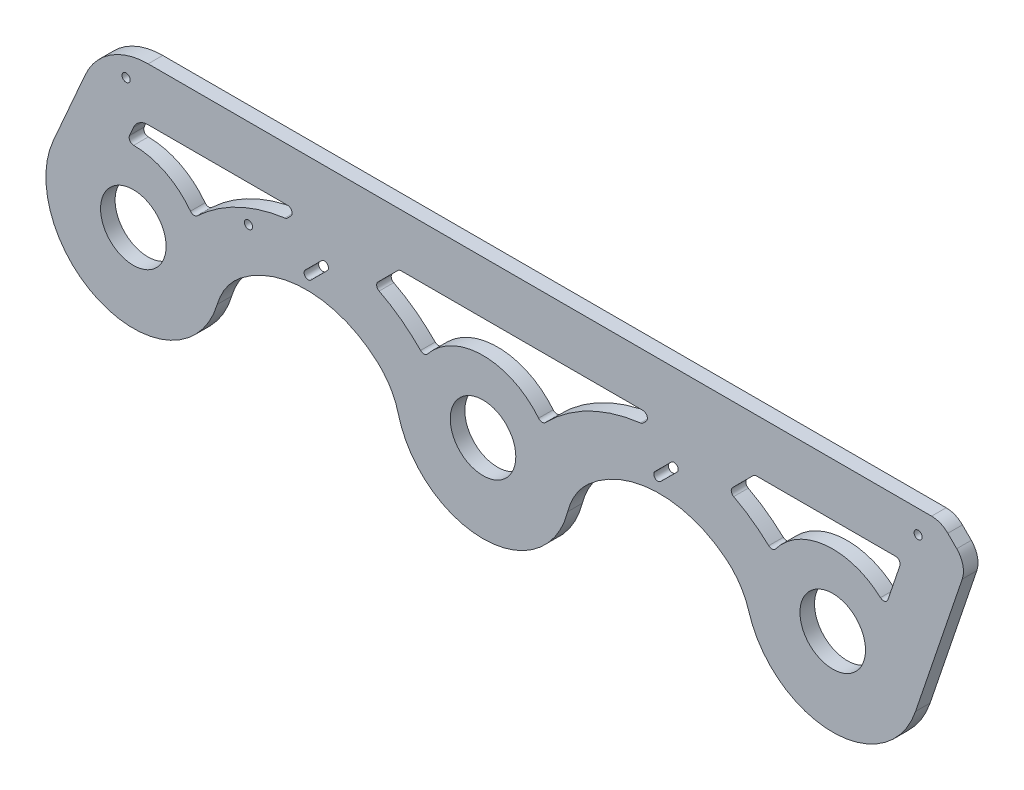
from build123d import *
from build123d.topology import SkipClean

# Parameters (mm, degrees)
SKETCH1_R           = 14.2875
BOSS_EXTRUDE1_DEPTH = 6.35
FILLET1_R           = 10
FILLET2_R           = 20
SKETCH2_R           = 1.778
CUT_EXTRUDE1_DEPTH  = 6.35
FILLET4_R           = 28.4734
BOSS_EXTRUDE2_DEPTH = 6.35
FILLET7_R           = 30
CUT_EXTRUDE4_DEPTH  = 6.35
FILLET9_DEPTH       = 6.35
SKETCH6_R           = 1.778
CUT_EXTRUDE5_DEPTH  = 10
CHAMFER1_SIZE       = 15
CHAMFER1_SIZE2      = 11.830755168
FILLET11_R          = 10
BOSS_EXTRUDE3_DEPTH = 6.35
SKETCH8_R           = 1.778
BOSS_EXTRUDE4_DEPTH = 6.35
CUT_EXTRUDE6_DEPTH  = 10
FILLET12_R          = 10
FILLET13_R          = 10
FILLET14_R          = 10
FILLET15_R          = 10
FILLET16_R          = 10
CUT_EXTRUDE7_DEPTH  = 10
BOSS_EXTRUDE5_START = -6.35
SKETCH10_R          = 1.778
BOSS_EXTRUDE5_DEPTH = 6.35
FILLET17_R          = 30
BOSS_EXTRUDE6_START = -6.35
BOSS_EXTRUDE6_DEPTH = 6.35
SCALE1_SCALE        = 0.333333333


with BuildPart() as part:
    # Sketch1 → Boss-Extrude1 (new body)
    with BuildSketch(Plane.XY):
        with BuildLine():
            Line((76.2, 30), (19.765397885, -21.612188753))
            ThreePointArc((19.765397885, -21.612188753), (-7.664310495, -28.266871084), (-27.975511048, -8.66766623))
            Line((-27.975511048, -8.66766623), (-30.661018302, 0))
            Line((-30.661018302, 0), (-10.522036605, 65))
            Line((-10.522036605, 65), (355.6, 65))
            Line((355.6, 65), (332.775511048, -8.66766623))
            ThreePointArc((332.775511048, -8.66766623), (312.464310495, -28.266871084), (285.034602115, -21.612188753))
            Line((285.034602115, -21.612188753), (228.6, 30))
            Line((228.6, 30), (172.803916322, -24.185422532))
            ThreePointArc((172.803916322, -24.185422532), (152.4, -32.637001398), (131.996083678, -24.185422532))
            Line((131.996083678, -24.185422532), (76.2, 30))
        make_face()
        Circle(SKETCH1_R, mode=Mode.SUBTRACT)
        with Locations((152.4, -3.175)):
            Circle(SKETCH1_R, mode=Mode.SUBTRACT)
        with Locations((304.8, 0)):
            Circle(SKETCH1_R, mode=Mode.SUBTRACT)
    extrude(amount=BOSS_EXTRUDE1_DEPTH)

    # Fillet1
    fillet1_edges = [part.edges().sort_by_distance(p)[0] for p in [
        (-10.522036605, 65, 3.175),
        (355.6, 65, 3.175),
    ]]
    fillet(fillet1_edges, radius=FILLET1_R)

    # Fillet2
    fillet2_edges = [part.edges().sort_by_distance(p)[0] for p in [
        (228.6, 30, 3.175),
        (76.2, 30, 3.175),
    ]]
    fillet(fillet2_edges, radius=FILLET2_R)

    # Sketch2 → Cut-Extrude1 (cut)
    with BuildSketch(Plane(origin=(0, 0, 0), x_dir=(-1, 0, 0), z_dir=(0, 0, -1))):
        with Locations((-229.01165953, 23.51851186)):
            Circle(SKETCH2_R)
        with Locations((-342.03271747, 55)):
            Circle(SKETCH2_R)
        with Locations((-76.34605429, 23.51851186)):
            Circle(SKETCH2_R)
        with Locations(Location((3.151363828, 55, 0), (0, 0, 180))):
            Circle(SKETCH2_R)
    extrude(amount=-CUT_EXTRUDE1_DEPTH, mode=Mode.SUBTRACT)

    # Fillet4
    fillet4_edges = [part.edges().sort_by_distance(p)[0] for p in [
        (-30.661018302, 0, 3.175),
    ]]
    fillet(fillet4_edges, radius=FILLET4_R)

    # Sketch4 → Boss-Extrude2 (add)
    with BuildSketch(Plane.XY.offset(6.35)):
        with BuildLine():
            ThreePointArc((-12.703394916, 57.95951045), (-9.084528898, 63.04969268), (-3.151363828, 65))
            Line((-3.151363828, 65), (-13.151363828, 65))
            Line((-13.151363828, 65), (-34.906140988, 15.269948308))
            ThreePointArc((-34.906140988, 15.269948308), (-10.316360553, -36.676732474), (37.748130536, -5.166105019))
            Line((37.748130536, -5.166105019), (19.765397885, -21.612188753))
            ThreePointArc((19.765397885, -21.612188753), (-7.664310495, -28.266871084), (-27.975511048, -8.66766623))
            Line((-27.975511048, -8.66766623), (-28.050159667, -8.426732485))
            ThreePointArc((-28.050159667, -8.426732485), (-29.325679471, 0), (-28.050159667, 8.426732485))
            Line((-28.050159667, 8.426732485), (-12.703394916, 57.95951045))
        make_face()
        with BuildLine():
            Line((367.03271747, 65), (342.03271747, 65))
            ThreePointArc((342.03271747, 65), (350.08241015, 60.93316507), (351.584748558, 52.04048955))
            Line((351.584748558, 52.04048955), (332.775511048, -8.66766623))
            ThreePointArc((332.775511048, -8.66766623), (312.464310495, -28.266871084), (285.034602115, -21.612188753))
            Line((285.034602115, -21.612188753), (267.051869464, -5.166105019))
            ThreePointArc((267.051869464, -5.166105019), (301.177259665, -37.927374711), (340.887568868, -12.218730424))
            Line((340.887568868, -12.218730424), (367.03271747, 65))
        make_face()
        with BuildLine():
            Line((62.290842982, 17.279399331), (60.592342389, 15.72603792))
            Line((60.592342389, 15.72603792), (68.130864542, 20.996768873))
            ThreePointArc((68.130864542, 20.996768873), (65.048790473, 19.392687011), (62.290842982, 17.279399331))
        make_face()
        with BuildLine():
            ThreePointArc((74.888341467, 22.500495492), (71.444046197, 22.043232685), (68.130864542, 20.996768873))
            Line((68.130864542, 20.996768873), (105.753753933, 1.29937195))
            Line((105.753753933, 1.29937195), (89.721872743, 16.868462091))
            ThreePointArc((89.721872743, 16.868462091), (84.206374965, 20.662880592), (77.747671619, 22.424549857))
            ThreePointArc((77.747671619, 22.424549857), (76.393262458, 25.295885031), (74.888341467, 22.500495492))
        make_face()
        with BuildLine():
            Line((220.832871891, 20.771986703), (256.207126926, 4.751939547))
            Line((256.207126926, 4.751939547), (242.509157018, 17.279399331))
            ThreePointArc((242.509157018, 17.279399331), (236.916143222, 20.892449631), (230.446997722, 22.469184326))
            ThreePointArc((230.446997722, 22.469184326), (229.01165953, 25.29651186), (227.576321337, 22.469184326))
            ThreePointArc((227.576321337, 22.469184326), (224.130268968, 21.915910418), (220.832871891, 20.771986703))
        make_face()
        with BuildLine():
            Line((211.556759647, 13.448745522), (220.832871891, 20.771986703))
            ThreePointArc((220.832871891, 20.771986703), (217.784547298, 19.072249628), (215.078127257, 16.868462091))
            Line((215.078127257, 16.868462091), (211.556759647, 13.448745522))
        make_face()
        with BuildLine():
            Line((131.996083678, -24.185422532), (114.514059271, -7.208050345))
            ThreePointArc((114.514059271, -7.208050345), (152.4, -41.275), (190.285940729, -7.208050345))
            Line((190.285940729, -7.208050345), (172.803916322, -24.185422532))
            ThreePointArc((172.803916322, -24.185422532), (152.4, -32.637001398), (131.996083678, -24.185422532))
        make_face()
    extrude(amount=-BOSS_EXTRUDE2_DEPTH)

    # Fillet7
    # the kernel refuses this fillet: 30 mm, written as the material it adds along each edge
    with BuildSketch(Plane(origin=(220.832871891, 20.771986703, 6.35), x_dir=(-0.7848829847834699, -0.6196440108621978, 0), z_dir=(0, 0, -1))) as fillet7_piece_1:
        with BuildLine():
            CenterArc((18.669895515, -29.207154991), FILLET7_R, 103.201773783, 49.45286053)
            Line((-7.977718615, -15.426564975), (0, 0))
            Line((0, 0), (11.818465203, 0))
        make_face()
    extrude(amount=6.35)
    with BuildSketch(Plane(origin=(68.130864542, 20.996768873, 6.35), x_dir=(-0.819550218760279, -0.5730073637659283, 0), z_dir=(0, 0, -1))) as fillet7_piece_2:
        with BuildLine():
            CenterArc((19.112116789, -28.314616862), FILLET7_R, 109.296600171, 43.297831689)
            Line((-7.521002941, -14.506034983), (0, 0))
            Line((0, 0), (9.198365128, 0))
        make_face()
    extrude(amount=6.35)
    # the kernel refuses this fillet: 30 mm, written as the material it takes off along each edge
    with BuildSketch(Plane(origin=(-13.151363828, 65, 55.403084312), x_dir=(-0.4007860448353176, -0.9161716794713002, 0), z_dir=(0, 0, -1))) as fillet7_2_piece_1:
        with BuildLine():
            CenterArc((FILLET7_R * 0.65404112416, -FILLET7_R), FILLET7_R, 90, 66.372672864)
            Line((-FILLET7_R * 0.262130555312, -FILLET7_R * 0.599213955165), (0, 0))
            Line((0, 0), (FILLET7_R * 0.65404112416, 0))
        make_face()
    extrude(amount=104.456168624, mode=Mode.SUBTRACT)

    # Sketch5 → Cut-Extrude4 (cut)
    with BuildSketch(Plane.XY.offset(6.35)):
        with BuildLine():
            ThreePointArc((202.727550006, 25.783673337), (222.609463156, 31.248183301), (242.841525508, 27.271376461))
            Line((242.841525508, 27.271376461), (264.569178734, 17.431507638))
            Line((264.569178734, 17.431507638), (281.763141289, 1.706792524))
            ThreePointArc((281.763141289, 1.706792524), (305.653980027, 23.084209281), (327.9, 0))
            ThreePointArc((327.9, 0), (327.592925131, -3.754006392), (326.679864589, -7.408206635))
            Line((326.679864589, -7.408206635), (346.117455511, 50))
            Line((346.117455511, 50), (6.469869897, 50))
            ThreePointArc((6.469869897, 50), (-1.740585021, 47.553423041), (-7.272705295, 41.011790673))
            Line((-7.272705295, 41.011790673), (-21.163565796, 9.258157636))
            ThreePointArc((-21.163565796, 9.258157636), (3.890126649, 22.770088156), (23.036858711, 1.706792524))
            Line((23.036858711, 1.706792524), (52.825875761, 28.950297628))
            ThreePointArc((52.825875761, 28.950297628), (71.4348738, 31.756464685), (89.564149012, 26.706834809))
            Line((89.564149012, 26.706834809), (114.641099784, 13.577841769))
            Line((114.641099784, 13.577841769), (129.424605527, -0.77890968))
            ThreePointArc((129.424605527, -0.77890968), (152.4, 19.925), (175.375394473, -0.77890968))
            Line((175.375394473, -0.77890968), (202.727550006, 25.783673337))
        make_face()
    extrude(amount=-CUT_EXTRUDE4_DEPTH, mode=Mode.SUBTRACT)

    # Fillet9: read off the stored shape, not the designer's step
    # Fillet9 outline → Fillet9 (add)
    with BuildSketch(Plane.XY):
        with BuildLine():
            Line((346.117455511, 50), (332.173947538, 50))
            ThreePointArc((332.173947538, 50), (340.300144637, 45.827943094), (341.64575039, 36.792984141))
            Line((341.64575039, 36.792984141), (346.117455511, 50))
        make_face()
        with BuildLine():
            Line((326.679864589, -7.408206635), (336.428348814, 21.383581349))
            ThreePointArc((336.428348814, 21.383581349), (329.483593888, 14.915162915), (320.262725429, 17.161413762))
            ThreePointArc((320.262725429, 17.161413762), (327.150253218, 5.837480712), (326.679864589, -7.408206635))
        make_face()
        with BuildLine():
            ThreePointArc((0.126311649, 23.099654659), (-8.202890478, 27.648769951), (-8.980724779, 37.107365609))
            Line((-8.980724779, 37.107365609), (-21.163565796, 9.258157636))
            ThreePointArc((-21.163565796, 9.258157636), (-12.591198333, 19.366768562), (0.126311649, 23.099654659))
        make_face()
    extrude(amount=FILLET9_DEPTH)

    # Sketch6 → Cut-Extrude5 (cut)
    with BuildSketch(Plane.XY.offset(6.35)):
        with Locations((76.2, 20.164023691)):
            Circle(SKETCH6_R)
        with Locations((228.6, 20.32759964)):
            Circle(SKETCH6_R)
    extrude(amount=-CUT_EXTRUDE5_DEPTH, mode=Mode.SUBTRACT)

    # Chamfer1
    chamfer1_edges = [part.edges().sort_by_distance(p)[0] for p in [
        (367.03271747, 65, 3.175),
    ]]
    chamfer1_side = [part.faces().sort_by_distance(p)[0] for p in [
        (186.751293683, 65, 3.175),
    ]]
    chamfer(chamfer1_edges, length=CHAMFER1_SIZE, length2=CHAMFER1_SIZE2, reference=chamfer1_side[0])

    # Fillet11
    fillet11_edges = [part.edges().sort_by_distance(p)[0] for p in [
        (363.238575525, 53.794141945, 3.175),
        (352.03271747, 65, 3.175),
    ]]
    fillet(fillet11_edges, radius=FILLET11_R)

    # Sketch7 → Boss-Extrude3 (add)
    with BuildSketch(Plane.XY.offset(6.35)):
        Polygon((100.225182041, 58.888519513), (69.228437645, 27.891775117), (86.023226415, 23.473360451), (115.72256861, 53.172702646), align=None)
        Polygon((224.083172996, 27.891775117), (239.038298252, 21.633696938), (270.57730396, 53.172702646), (247.971808558, 51.78041068), align=None)
    extrude(amount=-BOSS_EXTRUDE3_DEPTH)

    # Sketch8 → Boss-Extrude4 (add)
    # profile 1 of 8: a face of its own
    with BuildSketch(Plane.XY.offset(6.35)):
        with BuildLine():
            Line((42.965540082, 19.932541018), (26.540335697, 4.910892646))
            ThreePointArc((26.540335697, 4.910892646), (26.03493106, 4.232890698), (25.538925832, 3.547982455))
            Line((25.538925832, 3.547982455), (37.748130536, -5.166105019))
            ThreePointArc((37.748130536, -5.166105019), (44.188663643, 2.104358832), (52.003991477, 7.871573252))
            Line((52.003991477, 7.871573252), (60.592342389, 15.72603792))
            ThreePointArc((60.592342389, 15.72603792), (71.406290885, 16.717093686), (81.86459706, 13.793481951))
            ThreePointArc((81.86459706, 13.793481951), (100.496139451, 6.878937362), (114.514059271, -7.208050345))
            Line((114.514059271, -7.208050345), (127.169254419, 0.844653286))
            ThreePointArc((127.169254419, 0.844653286), (126.658671717, 1.633641021), (126.136055565, 2.414709969))
            Line((126.136055565, 2.414709969), (114.641099784, 13.577841769))
            Line((114.641099784, 13.577841769), (89.564149012, 26.706834809))
            ThreePointArc((89.564149012, 26.706834809), (89.463102992, 26.759574333), (89.361923711, 26.812057747))
            Line((89.361923711, 26.812057747), (90.030119482, 27.480253519))
            ThreePointArc((90.030119482, 27.480253519), (80.261374749, 29.051255746), (70.367134521, 29.030471993))
            ThreePointArc((70.367134521, 29.030471993), (56.12315118, 26.117501091), (42.965540082, 19.932541018))
        make_face()
        with Locations((76.2, 20.164023691)):
            Circle(SKETCH8_R, mode=Mode.SUBTRACT)
    # profile 2 of 8: a face of its own
    with BuildSketch(Plane.XY.offset(6.35)):
        with BuildLine():
            ThreePointArc((126.136055565, 2.414709969), (110.406465662, 18.294217169), (90.030119482, 27.480253519))
            Line((90.030119482, 27.480253519), (89.361923711, 26.812057747))
            ThreePointArc((89.361923711, 26.812057747), (89.463102992, 26.759574333), (89.564149012, 26.706834809))
            Line((89.564149012, 26.706834809), (114.641099784, 13.577841769))
            Line((114.641099784, 13.577841769), (126.136055565, 2.414709969))
        make_face()
    # profile 3 of 8: a face of its own
    with BuildSketch(Plane.XY.offset(6.35)):
        with BuildLine():
            Line((60.592342389, 15.72603792), (52.003991477, 7.871573252))
            ThreePointArc((52.003991477, 7.871573252), (66.43379909, 13.356222223), (81.86459706, 13.793481951))
            ThreePointArc((81.86459706, 13.793481951), (71.406290885, 16.717093686), (60.592342389, 15.72603792))
        make_face()
    # profile 4 of 8: a face of its own
    with BuildSketch(Plane.XY.offset(6.35)):
        with BuildLine():
            Line((196.372099466, 19.611685086), (178.663944435, 2.414709969))
            ThreePointArc((178.663944435, 2.414709969), (178.141328283, 1.633641021), (177.630745581, 0.844653286))
            Line((177.630745581, 0.844653286), (190.285940729, -7.208050345))
            ThreePointArc((190.285940729, -7.208050345), (197.093762385, 1.152818304), (205.650401581, 7.712885828))
            Line((205.650401581, 7.712885828), (211.556759647, 13.448745522))
            ThreePointArc((211.556759647, 13.448745522), (223.983698914, 16.277662761), (236.463614039, 13.692452762))
            ThreePointArc((236.463614039, 13.692452762), (253.661443339, 7.350945008), (267.051869464, -5.166105019))
            Line((267.051869464, -5.166105019), (279.261074168, 3.547982455))
            ThreePointArc((279.261074168, 3.547982455), (278.76506894, 4.232890698), (278.259664303, 4.910892646))
            Line((278.259664303, 4.910892646), (264.569178734, 17.431507638))
            Line((264.569178734, 17.431507638), (244.104163185, 26.699561871))
            Line((244.104163185, 26.699561871), (244.695857174, 27.29125586))
            ThreePointArc((244.695857174, 27.29125586), (235.069370607, 28.974257477), (225.297764534, 29.106366656))
            ThreePointArc((225.297764534, 29.106366656), (210.236231282, 26.182975027), (196.372099466, 19.611685086))
        make_face()
        with Locations((228.6, 20.32759964)):
            Circle(SKETCH8_R, mode=Mode.SUBTRACT)
    # profile 5 of 8: a face of its own
    with BuildSketch(Plane.XY.offset(6.35)):
        with BuildLine():
            Line((211.556759647, 13.448745522), (205.650401581, 7.712885828))
            ThreePointArc((205.650401581, 7.712885828), (220.5349661, 13.392794234), (236.463614039, 13.692452762))
            ThreePointArc((236.463614039, 13.692452762), (223.983698914, 16.277662761), (211.556759647, 13.448745522))
        make_face()
    # profile 6 of 8: a face of its own
    with BuildSketch(Plane.XY.offset(6.35)):
        with BuildLine():
            ThreePointArc((278.259664303, 4.910892646), (263.371186182, 18.940642396), (244.695857174, 27.29125586))
            Line((244.695857174, 27.29125586), (244.104163185, 26.699561871))
            Line((244.104163185, 26.699561871), (264.569178734, 17.431507638))
            Line((264.569178734, 17.431507638), (278.259664303, 4.910892646))
        make_face()
    # profile 7 of 8: a face of its own
    with BuildSketch(Plane.XY.offset(6.35)):
        with BuildLine():
            ThreePointArc((196.372099466, 19.611685086), (186.64361318, 11.913598089), (178.663944435, 2.414709969))
            Line((178.663944435, 2.414709969), (196.372099466, 19.611685086))
        make_face()
    # profile 8 of 8: a face of its own
    with BuildSketch(Plane.XY.offset(6.35)):
        with BuildLine():
            ThreePointArc((42.965540082, 19.932541018), (34.065540526, 13.173341548), (26.540335697, 4.910892646))
            Line((26.540335697, 4.910892646), (42.965540082, 19.932541018))
        make_face()
    extrude(amount=-BOSS_EXTRUDE4_DEPTH)

    # Sketch8<3> → Cut-Extrude6 (cut)
    with SkipClean():  # the faces are left unmerged after this step: merging them gives an invalid solid
        with BuildSketch(Plane.XY.offset(6.35)):
            with BuildLine():
                Line((26.540335697, 4.910892646), (23.036858711, 1.706792524))
                ThreePointArc((23.036858711, 1.706792524), (23.086771831, 0.781643421), (23.099546395, -0.144763074))
                ThreePointArc((23.099546395, -0.144763074), (24.756867192, 2.425991729), (26.540335697, 4.910892646))
            make_face()
            with BuildLine():
                Line((52.825875761, 28.950297628), (42.965540082, 19.932541018))
                ThreePointArc((42.965540082, 19.932541018), (56.12315118, 26.117501091), (70.367134521, 29.030471993))
                Line((70.367134521, 29.030471993), (72.972728384, 31.636065856))
                ThreePointArc((72.972728384, 31.636065856), (62.745683135, 31.445529161), (52.825875761, 28.950297628))
            make_face()
            with BuildLine():
                ThreePointArc((52.003991477, 7.871573252), (44.188663643, 2.104358832), (37.748130536, -5.166105019))
                Line((37.748130536, -5.166105019), (52.003991477, 7.871573252))
            make_face()
            with BuildLine():
                Line((105.753753933, 1.29937195), (114.514059271, -7.208050345))
                ThreePointArc((114.514059271, -7.208050345), (100.496139451, 6.878937362), (81.86459706, 13.793481951))
                ThreePointArc((81.86459706, 13.793481951), (82.236984648, 13.608280674), (82.606769012, 13.417934797))
                Line((82.606769012, 13.417934797), (105.753753933, 1.29937195))
            make_face()
            with BuildLine():
                ThreePointArc((126.136055565, 2.414709969), (127.78416506, -0.142246527), (129.303415047, -2.777805464))
                ThreePointArc((129.303415047, -2.777805464), (129.342339274, -1.777043687), (129.424605527, -0.77890968))
                Line((129.424605527, -0.77890968), (126.136055565, 2.414709969))
            make_face()
            with BuildLine():
                ThreePointArc((205.650401581, 7.712885828), (197.093762385, 1.152818304), (190.285940729, -7.208050345))
                Line((190.285940729, -7.208050345), (205.650401581, 7.712885828))
            make_face()
            with BuildLine():
                Line((256.207126926, 4.751939547), (267.051869464, -5.166105019))
                ThreePointArc((267.051869464, -5.166105019), (253.661443339, 7.350945008), (236.463614039, 13.692452762))
                ThreePointArc((236.463614039, 13.692452762), (236.558593891, 13.65003287), (236.653426084, 13.6072839))
                Line((236.653426084, 13.6072839), (256.207126926, 4.751939547))
            make_face()
            with BuildLine():
                ThreePointArc((175.496584953, -2.777805464), (177.01583494, -0.142246527), (178.663944435, 2.414709969))
                Line((178.663944435, 2.414709969), (175.375394473, -0.77890968))
                ThreePointArc((175.375394473, -0.77890968), (175.457660726, -1.777043687), (175.496584953, -2.777805464))
            make_face()
            with BuildLine():
                ThreePointArc((278.259664303, 4.910892646), (280.043132809, 2.425991728), (281.700453605, -0.144763074))
                ThreePointArc((281.700453605, -0.144763074), (281.713228169, 0.781643421), (281.763141289, 1.706792524))
                Line((281.763141289, 1.706792524), (278.259664303, 4.910892646))
            make_face()
            with BuildLine():
                Line((225.297764534, 29.106366656), (227.364470932, 31.173073053))
                ThreePointArc((227.364470932, 31.173073053), (214.660742934, 30.239572268), (202.727550006, 25.783673337))
                Line((202.727550006, 25.783673337), (196.372099466, 19.611685086))
                ThreePointArc((196.372099466, 19.611685086), (210.236231282, 26.182975027), (225.297764534, 29.106366656))
            make_face()
        extrude(amount=-CUT_EXTRUDE6_DEPTH, mode=Mode.SUBTRACT)

    # Fillet12
    fillet12_edges = [part.edges().sort_by_distance(p)[0] for p in [
        (23.099546395, -0.144763074, 3.175),
    ]]
    fillet(fillet12_edges, radius=FILLET12_R)

    # Fillet13
    fillet13_edges = [part.edges().sort_by_distance(p)[0] for p in [
        (129.303415047, -2.777805464, 3.175),
        (175.496584953, -2.777805464, 3.175),
        (281.700453605, -0.144763074, 3.175),
    ]]
    fillet(fillet13_edges, radius=FILLET13_R)

    # Fillet14
    fillet14_edges = [part.edges().sort_by_distance(p)[0] for p in [
        (225.297764534, 29.106366656, 3.175),
        (70.367134521, 29.030471993, 3.175),
    ]]
    fillet(fillet14_edges, radius=FILLET14_R)

    # Fillet15
    fillet15_edges = [part.edges().sort_by_distance(p)[0] for p in [
        (267.404601314, 50, 3.175),
        (91.336662528, 50, 3.175),
        (112.549865964, 50, 3.175),
        (244.695857174, 27.29125586, 3.175),
        (90.030119482, 27.480253519, 3.175),
    ]]
    fillet(fillet15_edges, radius=FILLET15_R)

    # Fillet16
    fillet16_edges = [part.edges().sort_by_distance(p)[0] for p in [
        (246.191397879, 50, 3.175),
    ]]
    fillet(fillet16_edges, radius=FILLET16_R)

    # Sketch9 → Cut-Extrude7 (cut)
    with SkipClean():  # the faces are left unmerged after this step: merging them gives an invalid solid
        with BuildSketch(Plane.XY.offset(6.35)):
            with BuildLine():
                Line((74.942764143, 21.421259548), (82.013831955, 28.49232736))
                ThreePointArc((82.013831955, 28.49232736), (84.528303669, 28.49232736), (84.528303669, 25.977855646))
                Line((84.528303669, 25.977855646), (77.457235857, 18.906787834))
                ThreePointArc((77.457235857, 18.906787834), (74.942764143, 18.906787834), (74.942764143, 21.421259548))
            make_face()
            with BuildLine():
                Line((227.342764143, 21.584835497), (234.413831955, 28.655903309))
                ThreePointArc((234.413831955, 28.655903309), (236.928303669, 28.655903309), (236.928303669, 26.141431595))
                Line((236.928303669, 26.141431595), (229.857235857, 19.070363783))
                ThreePointArc((229.857235857, 19.070363783), (227.342764143, 19.070363783), (227.342764143, 21.584835497))
            make_face()
        extrude(amount=-CUT_EXTRUDE7_DEPTH, mode=Mode.SUBTRACT)

    # Sketch10 → Boss-Extrude5 (add)
    # profile 1 of 3: a face of its own
    with SkipClean():  # the faces are left unmerged after this step: merging them gives an invalid solid
        with BuildSketch(Plane(origin=(0, 0, 0), x_dir=(-1, 0, 0), z_dir=(0, 0, -1)).offset(BOSS_EXTRUDE5_START)):
            with BuildLine():
                ThreePointArc((-67.194526904, 50), (-76.433322229, 43.826834324), (-74.265594716, 32.928932188))
                Line((-74.265594716, 32.928932188), (-72.848479306, 31.511816778))
                ThreePointArc((-72.848479306, 31.511816778), (-70.222953971, 29.625365286), (-67.132776867, 28.675161103))
                ThreePointArc((-67.132776867, 28.675161103), (-54.584312682, 25.583776849), (-42.962627059, 19.930721632))
                ThreePointArc((-42.962627059, 19.930721632), (-41.828685193, 19.205024398), (-40.71095078, 18.45460424))
                ThreePointArc((-40.71095078, 18.45460424), (-36.930649094, 15.635886475), (-33.378159261, 12.534972634))
                ThreePointArc((-33.378159261, 12.534972634), (-25.652977382, 9.847596586), (-18.506028464, 13.825227321))
                ThreePointArc((-18.506028464, 13.825227321), (-10.406477556, 20.623172037), (-0.126311649, 23.099654659))
                ThreePointArc((-0.126311649, 23.099654659), (8.202890478, 27.648769951), (8.980724779, 37.107365609))
                Line((8.980724779, 37.107365609), (7.272705295, 41.011790673))
                ThreePointArc((7.272705295, 41.011790673), (1.740585021, 47.553423041), (-6.469869897, 50))
                Line((-6.469869897, 50), (-67.194526904, 50))
            make_face()
            with Locations((-50.2, 26.164023691)):
                Circle(SKETCH10_R, mode=Mode.SUBTRACT)
            with BuildLine():
                Line((-69.3129454, 35.047350684), (-70.73006081, 36.464466094))
                ThreePointArc((-70.73006081, 36.464466094), (-71.813924567, 41.913417162), (-67.194526904, 45))
                Line((-67.194526904, 45), (-6.469869897, 45))
                ThreePointArc((-6.469869897, 45), (-0.996233285, 43.368948694), (2.691846898, 39.007860448))
                Line((2.691846898, 39.007860448), (4.399866381, 35.103435385))
                ThreePointArc((4.399866381, 35.103435385), (4.010949231, 30.374137556), (-0.153651832, 28.09957991))
                ThreePointArc((-0.153651832, 28.09957991), (-12.658961876, 25.087062088), (-22.511662331, 16.817700767))
                ThreePointArc((-22.511662331, 16.817700767), (-26.08513679, 14.8288854), (-29.947727729, 16.172573424))
                ThreePointArc((-29.947727729, 16.172573424), (-46.837281896, 27.753655452), (-66.455094181, 33.629022846))
                ThreePointArc((-66.455094181, 33.629022846), (-68.000182733, 34.104124938), (-69.3129454, 35.047350684))
            make_face(mode=Mode.SUBTRACT)
        # profile 2 of 3: a face of its own
        with BuildSketch(Plane(origin=(0, 0, 0), x_dir=(-1, 0, 0), z_dir=(0, 0, -1)).offset(BOSS_EXTRUDE5_START)):
            with BuildLine():
                ThreePointArc((-222.049262255, 50), (-231.28805758, 43.826834324), (-229.120330067, 32.928932188))
                Line((-229.120330067, 32.928932188), (-227.84247345, 31.651075572))
                ThreePointArc((-227.84247345, 31.651075572), (-225.148473717, 29.730965761), (-221.975427684, 28.794891452))
                ThreePointArc((-221.975427684, 28.794891452), (-202.106159082, 22.851738113), (-185.354998338, 10.624411336))
                ThreePointArc((-185.354998338, 10.624411336), (-177.7169483, 7.598630206), (-170.390122667, 11.315185866))
                ThreePointArc((-170.390122667, 11.315185866), (-152.4, 19.925), (-134.409877333, 11.315185866))
                ThreePointArc((-134.409877333, 11.315185866), (-127.0830517, 7.598630206), (-119.445001662, 10.624411336))
                ThreePointArc((-119.445001662, 10.624411336), (-111.941546557, 17.193098502), (-103.47246446, 22.458470097))
                ThreePointArc((-103.47246446, 22.458470097), (-98.164563741, 29.805562574), (-100.973163037, 38.423297073))
                Line((-100.973163037, 38.423297073), (-109.620933775, 47.071067812))
                ThreePointArc((-109.620933775, 47.071067812), (-112.865167264, 49.238795325), (-116.692001587, 50))
                Line((-116.692001587, 50), (-222.049262255, 50))
            make_face()
            with BuildLine():
                Line((-222.049262255, 45), (-116.692001587, 45))
                ThreePointArc((-116.692001587, 45), (-114.778584426, 44.619397663), (-113.156467681, 43.535533906))
                Line((-113.156467681, 43.535533906), (-104.508696943, 34.887763168))
                ThreePointArc((-104.508696943, 34.887763168), (-103.104397295, 30.578895918), (-105.758347654, 26.905349679))
                ThreePointArc((-105.758347654, 26.905349679), (-114.918098395, 21.210577706), (-123.033473552, 14.106202468))
                ThreePointArc((-123.033473552, 14.106202468), (-126.852498572, 12.593311904), (-130.515911388, 14.451589733))
                ThreePointArc((-130.515911388, 14.451589733), (-152.4, 24.925), (-174.284088612, 14.451589733))
                ThreePointArc((-174.284088612, 14.451589733), (-177.947501428, 12.593311904), (-181.766526448, 14.106202468))
                ThreePointArc((-181.766526448, 14.106202468), (-199.883774016, 27.330689399), (-221.373416661, 33.758517418))
                ThreePointArc((-221.373416661, 33.758517418), (-222.959939678, 34.226554572), (-224.306939544, 35.186609478))
                Line((-224.306939544, 35.186609478), (-225.584796161, 36.464466094))
                ThreePointArc((-225.584796161, 36.464466094), (-226.668659917, 41.913417162), (-222.049262255, 45))
            make_face(mode=Mode.SUBTRACT)
        # profile 3 of 3: a face of its own
        with BuildSketch(Plane(origin=(0, 0, 0), x_dir=(-1, 0, 0), z_dir=(0, 0, -1)).offset(BOSS_EXTRUDE5_START)):
            with BuildLine():
                ThreePointArc((-257.918824258, 22.181909427), (-252.690189928, 29.532193538), (-255.506229694, 38.10162838))
                Line((-255.506229694, 38.10162838), (-264.475669126, 47.071067812))
                ThreePointArc((-264.475669126, 47.071067812), (-267.719902614, 49.238795325), (-271.546736938, 50))
                Line((-271.546736938, 50), (-332.173947538, 50))
                ThreePointArc((-332.173947538, 50), (-340.300144637, 45.827943094), (-341.64575039, 36.792984141))
                Line((-341.64575039, 36.792984141), (-336.428348814, 21.383581349))
                ThreePointArc((-336.428348814, 21.383581349), (-329.483593889, 14.915162915), (-320.262725429, 17.161413762))
                ThreePointArc((-320.262725429, 17.161413762), (-302.54213412, 22.989389763), (-286.293971536, 13.825227321))
                ThreePointArc((-286.293971536, 13.825227321), (-279.147022618, 9.847596586), (-271.421840739, 12.534972634))
                ThreePointArc((-271.421840739, 12.534972634), (-264.998233798, 17.817411245), (-257.918824258, 22.181909427))
            make_face()
            with BuildLine():
                Line((-268.011203032, 43.535533906), (-259.0417636, 34.566094474))
                ThreePointArc((-259.0417636, 34.566094474), (-257.633743717, 30.281377053), (-260.248060882, 26.606234998))
                ThreePointArc((-260.248060882, 26.606234998), (-267.904808807, 21.885804259), (-274.852272271, 16.172573424))
                ThreePointArc((-274.852272271, 16.172573424), (-278.71486321, 14.8288854), (-282.288337669, 16.817700767))
                ThreePointArc((-282.288337669, 16.817700767), (-302.053418561, 27.965448153), (-323.609635695, 20.876005485))
                ThreePointArc((-323.609635695, 20.876005485), (-328.220069925, 19.752880062), (-331.692447387, 22.987089279))
                Line((-331.692447387, 22.987089279), (-336.909848964, 38.39649207))
                ThreePointArc((-336.909848964, 38.39649207), (-336.237046087, 42.913971547), (-332.173947538, 45))
                Line((-332.173947538, 45), (-271.546736938, 45))
                ThreePointArc((-271.546736938, 45), (-269.633319776, 44.619397663), (-268.011203032, 43.535533906))
            make_face(mode=Mode.SUBTRACT)
        extrude(amount=BOSS_EXTRUDE5_DEPTH)

    # Fillet17
    fillet17_edges = [part.edges().sort_by_distance(p)[0] for p in [
        (190.285940729, -7.208050345, 3.175),
        (267.051869464, -5.166105019, 3.175),
        (114.514059271, -7.208050345, 3.175),
        (37.748130536, -5.166105019, 3.175),
    ]]
    fillet(fillet17_edges, radius=FILLET17_R)

    # Boss-Extrude6: read off the stored shape, not the designer's step
    # Boss-Extrude6 outline → Boss-Extrude6 (add)
    # profile 1 of 3: a face of its own
    with SkipClean():  # the faces are left unmerged after this step: merging them gives an invalid solid
        with BuildSketch(Plane(origin=(0, 0, 0), x_dir=(-1, 0, 0), z_dir=(0, 0, -1)).offset(BOSS_EXTRUDE6_START)):
            with BuildLine():
                ThreePointArc((-66.455094181, 33.629022846), (-46.837281896, 27.753655452), (-29.947727729, 16.172573424))
                ThreePointArc((-29.947727729, 16.172573424), (-26.08513679, 14.8288854), (-22.511662331, 16.817700767))
                ThreePointArc((-22.511662331, 16.817700767), (-12.658961876, 25.087062088), (-0.153651832, 28.09957991))
                ThreePointArc((-0.153651832, 28.09957991), (4.010949231, 30.374137556), (4.399866381, 35.103435385))
                Line((4.399866381, 35.103435385), (2.691846898, 39.007860448))
                ThreePointArc((2.691846898, 39.007860448), (-0.996233285, 43.368948694), (-6.469869897, 45))
                Line((-6.469869897, 45), (-67.194526904, 45))
                ThreePointArc((-67.194526904, 45), (-71.813924567, 41.913417162), (-70.73006081, 36.464466094))
                Line((-70.73006081, 36.464466094), (-69.3129454, 35.047350684))
                ThreePointArc((-69.3129454, 35.047350684), (-68.000182733, 34.104124938), (-66.455094181, 33.629022846))
            make_face()
            with BuildLine():
                Line((-0.05666814, 37.805502314), (1.651351343, 33.90107725))
                ThreePointArc((1.651351343, 33.90107725), (1.495784483, 32.009358118), (-0.170055943, 31.09953506))
                ThreePointArc((-0.170055943, 31.09953506), (-14.010452468, 27.765396119), (-24.915042651, 18.613184835))
                ThreePointArc((-24.915042651, 18.613184835), (-26.344432434, 17.817658688), (-27.88946881, 18.355133898))
                ThreePointArc((-27.88946881, 18.355133898), (-45.543132337, 30.460161857), (-66.048484569, 36.601339893))
                ThreePointArc((-66.048484569, 36.601339893), (-66.66651999, 36.791380729), (-67.191625057, 37.168671028))
                Line((-67.191625057, 37.168671028), (-68.608740467, 38.585786438))
                ThreePointArc((-68.608740467, 38.585786438), (-69.042285969, 40.765366865), (-67.194526904, 42))
                Line((-67.194526904, 42), (-6.469869897, 42))
                ThreePointArc((-6.469869897, 42), (-2.638324268, 40.858264086), (-0.05666814, 37.805502314))
            make_face(mode=Mode.SUBTRACT)
        # profile 2 of 3: a face of its own
        with BuildSketch(Plane(origin=(0, 0, 0), x_dir=(-1, 0, 0), z_dir=(0, 0, -1)).offset(BOSS_EXTRUDE6_START)):
            with BuildLine():
                ThreePointArc((-123.033473552, 14.106202468), (-114.918098395, 21.210577706), (-105.758347654, 26.905349679))
                ThreePointArc((-105.758347654, 26.905349679), (-103.104397295, 30.578895918), (-104.508696943, 34.887763168))
                Line((-104.508696943, 34.887763168), (-113.156467681, 43.535533906))
                ThreePointArc((-113.156467681, 43.535533906), (-114.778584425, 44.619397663), (-116.692001587, 45))
                Line((-116.692001587, 45), (-222.049262255, 45))
                ThreePointArc((-222.049262255, 45), (-226.668659917, 41.913417162), (-225.584796161, 36.464466094))
                Line((-225.584796161, 36.464466094), (-224.306939544, 35.186609478))
                ThreePointArc((-224.306939544, 35.186609478), (-222.959939678, 34.226554572), (-221.373416661, 33.758517418))
                ThreePointArc((-221.373416661, 33.758517418), (-199.883774016, 27.330689399), (-181.766526448, 14.106202468))
                ThreePointArc((-181.766526448, 14.106202468), (-177.947501429, 12.593311904), (-174.284088612, 14.451589733))
                ThreePointArc((-174.284088612, 14.451589733), (-152.4, 24.925), (-130.515911388, 14.451589733))
                ThreePointArc((-130.515911388, 14.451589733), (-126.852498571, 12.593311904), (-123.033473552, 14.106202468))
            make_face()
            with BuildLine():
                ThreePointArc((-106.630017287, 32.766442824), (-106.068297427, 31.042895924), (-107.129877571, 29.573477429))
                ThreePointArc((-107.129877571, 29.573477429), (-116.704029498, 23.621065228), (-125.186556687, 16.195277148))
                ThreePointArc((-125.186556687, 16.195277148), (-126.714166695, 15.590120922), (-128.179531821, 16.333432054))
                ThreePointArc((-128.179531821, 16.333432054), (-152.4, 27.925), (-176.620468179, 16.333432054))
                ThreePointArc((-176.620468179, 16.333432054), (-178.085833305, 15.590120922), (-179.613443313, 16.195277148))
                ThreePointArc((-179.613443313, 16.195277148), (-198.550342977, 30.01806017), (-221.012210047, 36.736692997))
                ThreePointArc((-221.012210047, 36.736692997), (-221.646819254, 36.923907859), (-222.185619201, 37.307929821))
                Line((-222.185619201, 37.307929821), (-223.463475817, 38.585786438))
                ThreePointArc((-223.463475817, 38.585786438), (-223.89702132, 40.765366865), (-222.049262255, 42))
                Line((-222.049262255, 42), (-116.692001587, 42))
                ThreePointArc((-116.692001587, 42), (-115.926634722, 41.847759065), (-115.277788025, 41.414213562))
                Line((-115.277788025, 41.414213562), (-106.630017287, 32.766442824))
            make_face(mode=Mode.SUBTRACT)
        # profile 3 of 3: a face of its own
        with BuildSketch(Plane(origin=(0, 0, 0), x_dir=(-1, 0, 0), z_dir=(0, 0, -1)).offset(BOSS_EXTRUDE6_START)):
            with BuildLine():
                ThreePointArc((-268.011203032, 43.535533906), (-269.633319776, 44.619397663), (-271.546736938, 45))
                Line((-271.546736938, 45), (-332.173947538, 45))
                ThreePointArc((-332.173947538, 45), (-336.237046087, 42.913971546), (-336.909848964, 38.39649207))
                Line((-336.909848964, 38.39649207), (-331.692447387, 22.987089279))
                ThreePointArc((-331.692447387, 22.987089279), (-328.220069925, 19.752880062), (-323.609635695, 20.876005485))
                ThreePointArc((-323.609635695, 20.876005485), (-302.053418561, 27.965448153), (-282.288337669, 16.817700767))
                ThreePointArc((-282.288337669, 16.817700767), (-278.71486321, 14.8288854), (-274.852272271, 16.172573424))
                ThreePointArc((-274.852272271, 16.172573424), (-267.904808807, 21.885804259), (-260.248060882, 26.606234998))
                ThreePointArc((-260.248060882, 26.606234998), (-257.633743717, 30.281377053), (-259.0417636, 34.566094474))
                Line((-259.0417636, 34.566094474), (-268.011203032, 43.535533906))
            make_face()
            with BuildLine():
                Line((-332.173947538, 42), (-271.546736938, 42))
                ThreePointArc((-271.546736938, 42), (-270.781370073, 41.847759065), (-270.132523375, 41.414213562))
                Line((-270.132523375, 41.414213562), (-261.163083943, 32.44477413))
                ThreePointArc((-261.163083943, 32.44477413), (-260.59987599, 30.730887162), (-261.645602856, 29.26083034))
                ThreePointArc((-261.645602856, 29.26083034), (-269.648753813, 24.326840067), (-276.91053119, 18.355133898))
                ThreePointArc((-276.91053119, 18.355133898), (-278.455567566, 17.817658688), (-279.884957349, 18.613184835))
                ThreePointArc((-279.884957349, 18.613184835), (-301.760189226, 30.951083187), (-325.617781855, 23.104760519))
                ThreePointArc((-325.617781855, 23.104760519), (-327.461955547, 22.65551035), (-328.850906532, 23.949194037))
                Line((-328.850906532, 23.949194037), (-334.068308108, 39.358596828))
                ThreePointArc((-334.068308108, 39.358596828), (-333.799186957, 41.165588618), (-332.173947538, 42))
            make_face(mode=Mode.SUBTRACT)
        extrude(amount=BOSS_EXTRUDE6_DEPTH)


with BuildPart() as part_1:
    # Scale1: scaled about (162.064336111, 21.954720036, 3.175)
    add(part.part.scale(SCALE1_SCALE).moved(Location((108.042890741, 14.636480024, 2.116666667))))


solid = part_1.part
